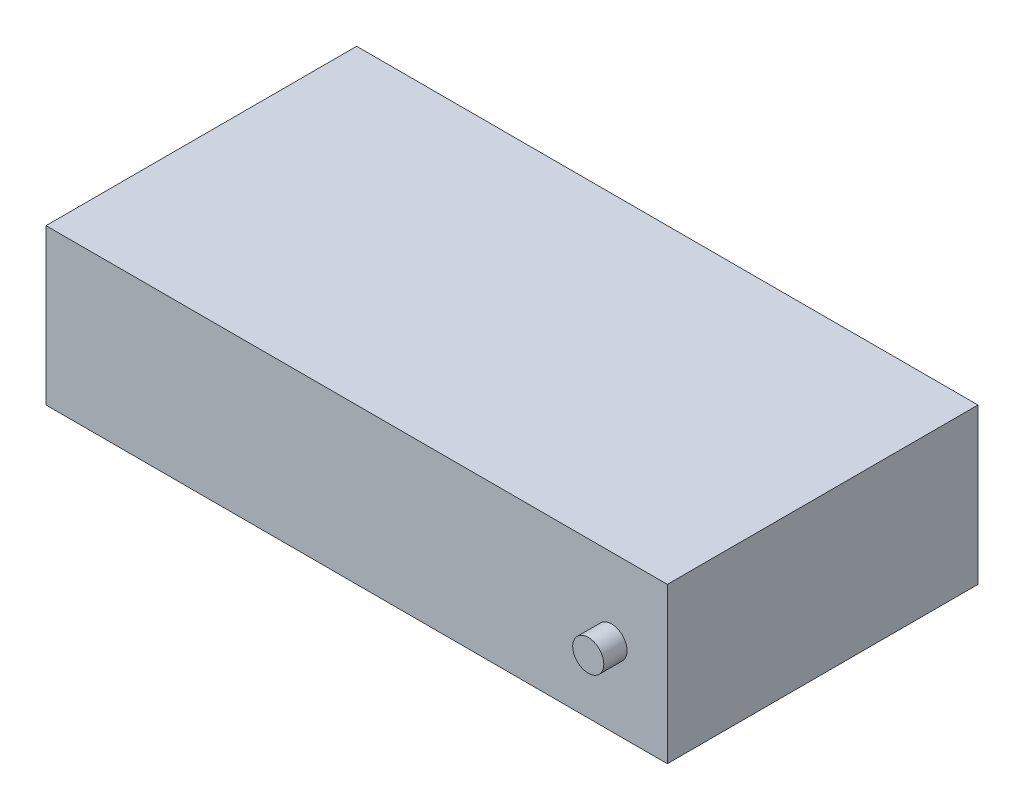
from build123d import *

# Parameters (mm, degrees)
SKETCH3_W               = 80
SKETCH3_H               = 40
BOSS_EXTRUDE1_DEPTH     = 20
SKETCH5_R               = 2
CUT_EXTRUDE2_DEPTH      = 40
BOSS_EXTRUDE2_START     = -23
BOSS_EXTRUDE2_OUTLINE_R = 2
BOSS_EXTRUDE2_DEPTH     = 46


# Read off the part's stored shape, not the designer's step: Boss-Extrude2
with BuildPart() as part:
    # Sketch3 → Boss-Extrude1 (new body)
    with BuildSketch(Plane(origin=(0, 0, 0), x_dir=(1, 0, 0), z_dir=(0, 1, 0))):
        Rectangle(SKETCH3_W, SKETCH3_H)
    extrude(amount=BOSS_EXTRUDE1_DEPTH)

    # Sketch5 → Cut-Extrude2 (cut)
    with BuildSketch(Plane.XY.offset(20)):
        with Locations((32.81740635, 10)):
            Circle(SKETCH5_R)
    extrude(amount=-CUT_EXTRUDE2_DEPTH, mode=Mode.SUBTRACT)

    # Boss-Extrude2 outline → Boss-Extrude2 (add)
    with BuildSketch(Plane.XY.offset(BOSS_EXTRUDE2_START)):
        with Locations((32.81740635, 10)):
            Circle(BOSS_EXTRUDE2_OUTLINE_R)
    extrude(amount=BOSS_EXTRUDE2_DEPTH)


solid = part.part
